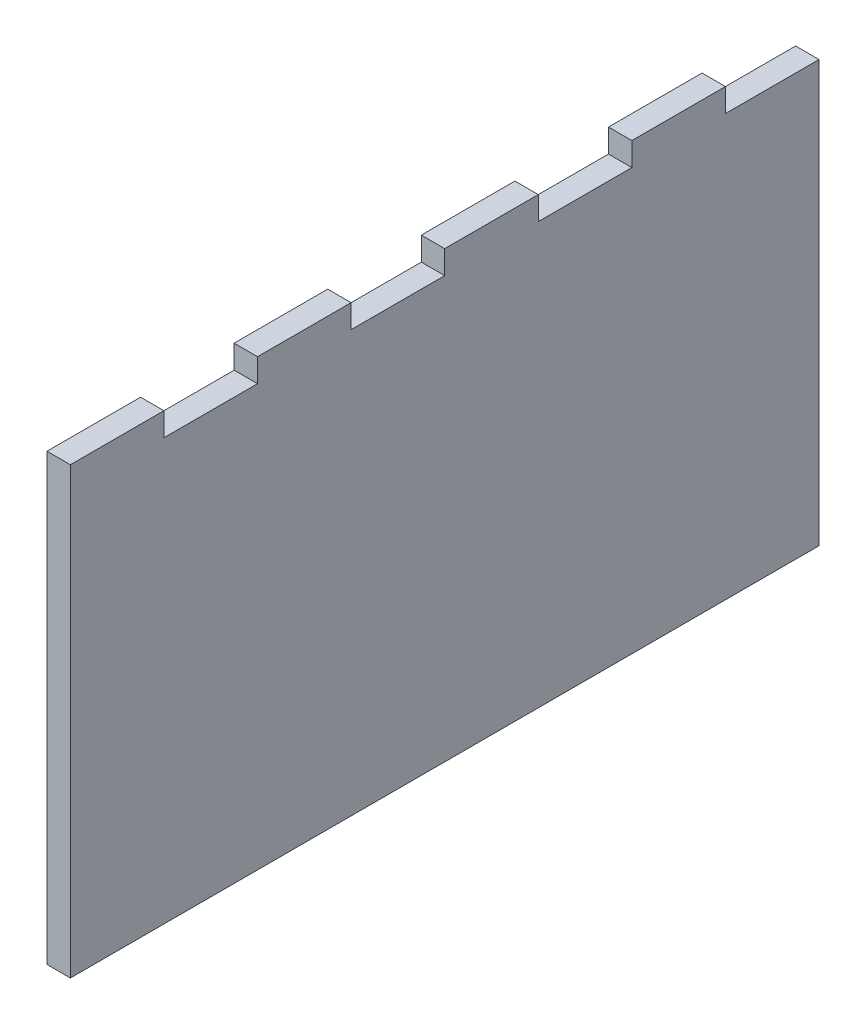
from build123d import *

# Parameters (mm, degrees)
BOSS_EXTRUDE1_DEPTH = 3.175


with BuildPart() as part:
    # Sketch1 → Boss-Extrude1 (new body)
    with BuildSketch(Plane(origin=(0, 0, 0), x_dir=(0, 0, -1), z_dir=(1, 0, 0))):
        Polygon((0, 0), (0, 60.325), (12.7, 60.325), (12.7, 57.15), (25.4, 57.15), (25.4, 60.325), (38.1, 60.325), (38.1, 57.15), (50.8, 57.15), (50.8, 60.325), (63.5, 60.325), (63.5, 57.15), (76.2, 57.15), (76.2, 60.325), (88.9, 60.325), (88.9, 57.15), (101.6, 57.15), (101.6, 0), align=None)
    extrude(amount=BOSS_EXTRUDE1_DEPTH)


solid = part.part
